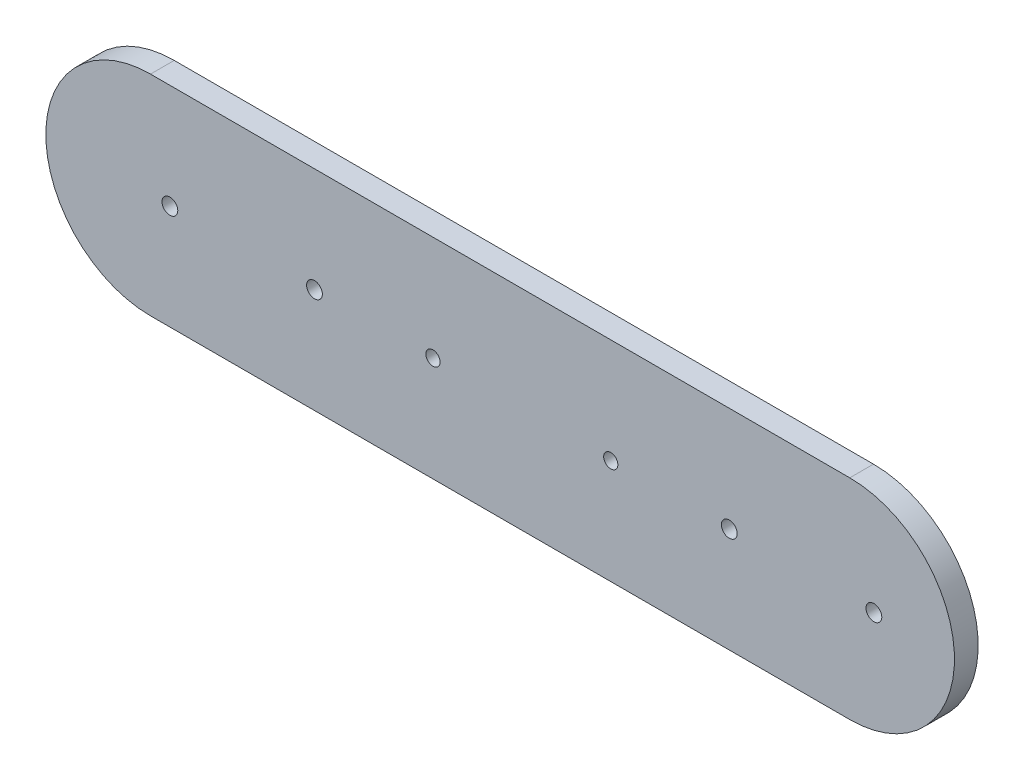
from build123d import *

# Parameters (mm, degrees)
ESBO_O1_R                = 1.8
ESBO_O1_R_2              = 2
RESSALTO_EXTRUS_O1_DEPTH = 6


with BuildPart() as part:
    # Esboço1 → Ressalto-extrusão1 (new body)
    with BuildSketch(Plane.XY):
        with BuildLine():
            Line((-94, 26.5), (83, 26.5))
            ThreePointArc((83, 26.5), (109.5, 0), (83, -26.5))
            Line((83, -26.5), (-94, -26.5))
            ThreePointArc((-94, -26.5), (-120.5, 0), (-94, 26.5))
        make_face()
        with Locations((-22.5, 0)):
            Circle(ESBO_O1_R, mode=Mode.SUBTRACT)
        with Locations((22.5, 0)):
            Circle(ESBO_O1_R, mode=Mode.SUBTRACT)
        with Locations((-89.1, 0)):
            Circle(ESBO_O1_R_2, mode=Mode.SUBTRACT)
        with Locations((-52.5, 0)):
            Circle(ESBO_O1_R_2, mode=Mode.SUBTRACT)
        with Locations((52.5, 0)):
            Circle(ESBO_O1_R_2, mode=Mode.SUBTRACT)
        with Locations((89.1, 0)):
            Circle(ESBO_O1_R_2, mode=Mode.SUBTRACT)
    extrude(amount=RESSALTO_EXTRUS_O1_DEPTH)


solid = part.part
